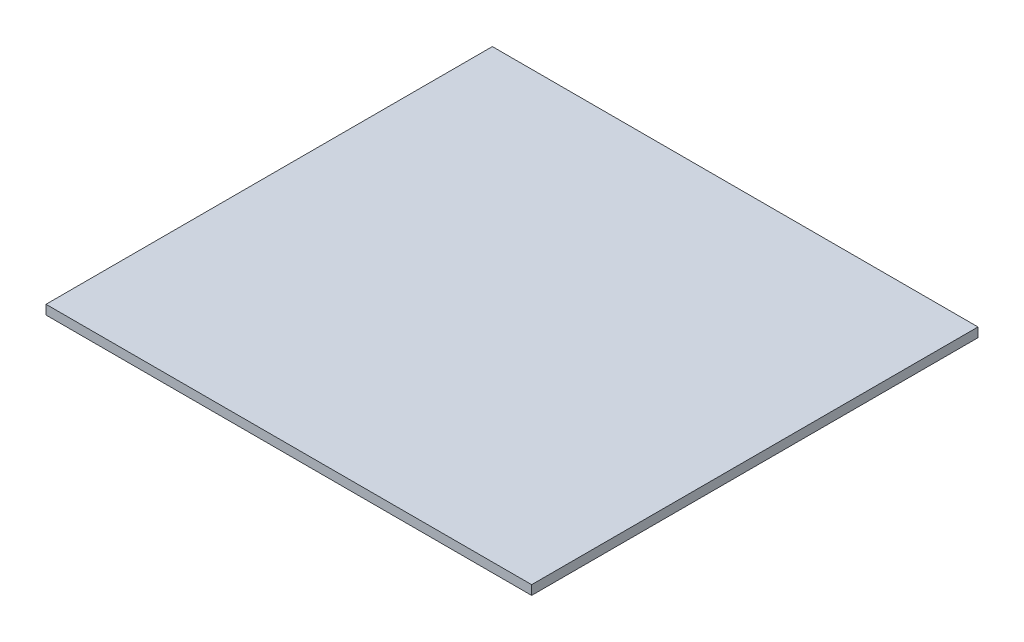
from build123d import *

# Parameters (mm, degrees)
CROQUIS1_W              = 330
CROQUIS1_H              = 303.31
SALIENTE_EXTRUIR2_DEPTH = 6.35


with BuildPart() as part:
    # Croquis1 → Saliente-Extruir2 (new body)
    with BuildSketch(Plane(origin=(0, 0, 0), x_dir=(1, 0, 0), z_dir=(0, 1, 0))):
        Rectangle(CROQUIS1_W, CROQUIS1_H)
    extrude(amount=SALIENTE_EXTRUIR2_DEPTH)


solid = part.part
